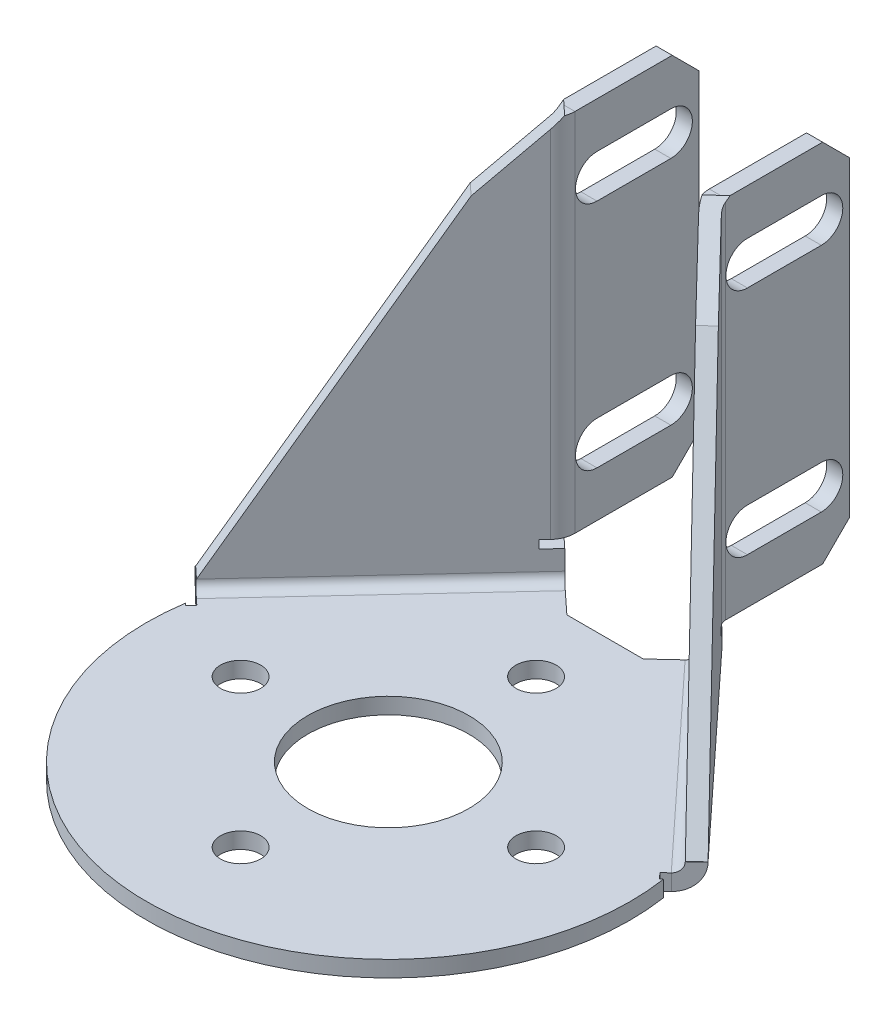
from build123d import *
from OCP.BRepFilletAPI import BRepFilletAPI_MakeChamfer

# Parameters (mm, degrees)
T_LE_DE_BASE_PLI_E1_DEPTH       = 1.2
ESQUISSE12_R                    = 1.5
ESQUISSE12_R_2                  = 6
ENL_V_MAT_EXTRU_1_DEPTH         = 26.579729358
T_LE_START                      = -10.493561241
T_LE_PLI_E_SUR_AR_TE1_OUTLINE_W = 1.3366
T_LE_PLI_E_SUR_AR_TE1_OUTLINE_H = 1.2
T_LE_PLI_E_SUR_AR_TE1_DEPTH     = 0.6
T_LE_START_2                    = 9.540892015
T_LE_PLI_E_SUR_AR_TE1_2_DEPTH   = 0.6
T_LE_START_3                    = -9.893561241
T_LE_PLI_E_SUR_AR_TE1_3_DEPTH   = 19.434453256
T_LE_PLI_E_SUR_AR_TE1_4_DEPTH   = 2
T_LE_PLI_E_SUR_AR_TE1_5_DEPTH   = 19.434453256
T_LE_START_4                    = 16
T_LE_PLI_E_SUR_AR_TE1_6_DEPTH   = 1.2
T_LE_START_5                    = 2.2
T_LE_PLI_E_SUR_AR_TE2_DEPTH     = 27.8
T_LE_PLI_E_SUR_AR_TE2_2_DEPTH   = 0.6
T_LE_START_6                    = 2.8
T_LE_PLI_E_SUR_AR_TE2_3_DEPTH   = 27.2
CHANFREIN1_SIZE                 = 2
CHANFREIN1_SIZE2                = 5.740607303
CHANFREIN1_OF_SYM_TRIE1_SIZE    = 2
CHANFREIN1_OF_SYM_TRIE1_SIZE2   = 5.740607303
ENL_V_MAT_EXTRU_2_DEPTH         = 46.34668098
ENL_V_MAT_EXTRU_2_DEPTH_BACK    = 46.34668098
ENL_V_MAT_EXTRU_7_DEPTH         = 2


with BuildPart() as part:
    # Tôle de base pliée1: sheet metal written as solids
    # Esquisse1 → Tôle de base pliée1 (new body)
    with BuildSketch(Plane(origin=(0, 0, 0), x_dir=(1, 0, 0), z_dir=(0, 1, 0))):
        with BuildLine():
            Line((-5, 18.135119355), (-17.337811592, 4.837384541))
            ThreePointArc((-17.337811592, 4.837384541), (0, -18), (17.337811592, 4.837384541))
            Line((17.337811592, 4.837384541), (5, 18.135119355))
            Line((5, 18.135119355), (-5, 18.135119355))
        make_face()
    extrude(amount=-T_LE_DE_BASE_PLI_E1_DEPTH)

    # Esquisse12 → Enlèv. mat.-Extru.1 (cut, through all)
    with BuildSketch(Plane(origin=(0, 0, 0), x_dir=(1, 0, 0), z_dir=(0, 1, 0))):
        with Locations(Location((11, 0, 0), (0, 0, 270))):
            Circle(ESQUISSE12_R)
        with Locations(Location((0, 11, 0), (0, 0, 270))):
            Circle(ESQUISSE12_R)
        with Locations(Location((-11, 0, 0), (0, 0, 270))):
            Circle(ESQUISSE12_R)
        with Locations(Location((0, -11, 0), (0, 0, 270))):
            Circle(ESQUISSE12_R)
        with Locations(Location((0, 0, 0), (0, 0, 270))):
            Circle(ESQUISSE12_R_2)
    extrude(amount=-ENL_V_MAT_EXTRU_1_DEPTH, mode=Mode.SUBTRACT)

    # Tôle pliée sur arête1: read off the stored shape, not the designer's step
    # Tôle pliée sur arête1 outline → Tôle pliée sur arête1 (cut)
    with BuildSketch(Plane(origin=(0, 0, 0), x_dir=(0.7330706501266544, 0, -0.6801524990198037), z_dir=(0.6801524990198037, 0, 0.7330706501266546)).offset(T_LE_START)):
        with Locations((15.3317, -0.6)):
            Rectangle(T_LE_PLI_E_SUR_AR_TE1_OUTLINE_W, T_LE_PLI_E_SUR_AR_TE1_OUTLINE_H)
    t_le_pli_e_sur_ar_te1 = extrude(amount=T_LE_PLI_E_SUR_AR_TE1_DEPTH, mode=Mode.SUBTRACT)

    # T_le pli_e sur ar_te1 2 outline → T_le pli_e sur ar_te1 2 (cut)
    with BuildSketch(Plane(origin=(0, 0, 0), x_dir=(0.7330706501266544, 0, -0.6801524990198037), z_dir=(0.6801524990198037, 0, 0.7330706501266546)).offset(T_LE_START_2)):
        with BuildLine():
            Line((14.6634, 0), (14.6634, -1.2))
            Line((14.6634, -1.2), (15.2634, -1.2))
            ThreePointArc((15.2634, -1.2), (15.638821762, -1.163262642), (16, -1.054444388))
            Line((16, -1.054444388), (16, 0))
            Line((16, 0), (14.6634, 0))
        make_face()
    t_le_pli_e_sur_ar_te1_2 = extrude(amount=T_LE_PLI_E_SUR_AR_TE1_2_DEPTH, mode=Mode.SUBTRACT)

    # T_le pli_e sur ar_te1 3 outline → T_le pli_e sur ar_te1 3 (cut)
    with BuildSketch(Plane(origin=(0, 0, 0), x_dir=(0.7330706501266544, 0, -0.6801524990198037), z_dir=(0.6801524990198037, 0, 0.7330706501266546)).offset(T_LE_START_3)):
        with BuildLine():
            ThreePointArc((16, -1.054444388), (15.638821762, -1.163262642), (15.2634, -1.2))
            Line((15.2634, -1.2), (16, -1.2))
            Line((16, -1.2), (16, -1.054444388))
        make_face()
    t_le_pli_e_sur_ar_te1_3 = extrude(amount=T_LE_PLI_E_SUR_AR_TE1_3_DEPTH, mode=Mode.SUBTRACT)

    # T_le pli_e sur ar_te1 4 outline → T_le pli_e sur ar_te1 4 (add)
    with BuildSketch(Plane(origin=(0, 0, 0), x_dir=(0.7330706501266544, 0, -0.6801524990198037), z_dir=(0.6801524990198037, 0, 0.7330706501266546)).offset(T_LE_START_3)):
        with BuildLine():
            ThreePointArc((16, 0.7366), (15.784254855, 0.215745145), (15.2634, 0))
            Line((15.2634, 0), (16, 0))
            Line((16, 0), (16, -1.054444388))
            ThreePointArc((16, -1.054444388), (16.872269031, -0.341342484), (17.2, 0.7366))
            Line((17.2, 0.7366), (17.2, 30))
            Line((17.2, 30), (16, 30))
            Line((16, 30), (16, 0.7366))
        make_face()
    t_le_pli_e_sur_ar_te1_4 = extrude(amount=T_LE_PLI_E_SUR_AR_TE1_4_DEPTH)

    # T_le pli_e sur ar_te1 5 outline → T_le pli_e sur ar_te1 5 (add)
    with BuildSketch(Plane(origin=(0, 0, 0), x_dir=(0.7330706501266544, 0, -0.6801524990198037), z_dir=(0.6801524990198037, 0, 0.7330706501266546)).offset(T_LE_START_3)):
        with BuildLine():
            Line((14.6634, 0), (14.6634, -1.2))
            Line((14.6634, -1.2), (15.2634, -1.2))
            ThreePointArc((15.2634, -1.2), (16.632782992, -0.632782992), (17.2, 0.7366))
            Line((17.2, 0.7366), (16, 0.7366))
            ThreePointArc((16, 0.7366), (15.784254855, 0.215745145), (15.2634, 0))
            Line((15.2634, 0), (14.6634, 0))
        make_face()
    t_le_pli_e_sur_ar_te1_5 = extrude(amount=T_LE_PLI_E_SUR_AR_TE1_5_DEPTH)

    # T_le pli_e sur ar_te1 6 outline → T_le pli_e sur ar_te1 6 (add)
    with BuildSketch(Plane(origin=(0, 0, 0), x_dir=(0.6801524990198036, 0, 0.7330706501266546), z_dir=(0.7330706501266546, 0, -0.6801524990198037)).offset(T_LE_START_4)):
        Polygon((-7.893561241, -30), (9.508185371, -0.7366), (-7.893561241, -0.7366), align=None)
    t_le_pli_e_sur_ar_te1_6 = extrude(amount=T_LE_PLI_E_SUR_AR_TE1_6_DEPTH)

    # Tôle pliée sur arête2: read off the stored shape, not the designer's step
    # Tôle pliée sur arête2 outline → Tôle pliée sur arête2 (cut)
    with BuildSketch(Plane(origin=(0, 0, 0), x_dir=(1, 0, 0), z_dir=(0, 1, 0)).offset(T_LE_START_5)):
        with BuildLine():
            Line((5, 18.135119355), (5.516935379, 17.577964666))
            ThreePointArc((5.516935379, 17.577964666), (5.281888127, 17.88899285), (5.113898069, 18.240795467))
            Line((5.113898069, 18.240795467), (5, 18.135119355))
        make_face()
    t_le_pli_e_sur_ar_te2 = extrude(amount=T_LE_PLI_E_SUR_AR_TE2_DEPTH, mode=Mode.SUBTRACT)

    # T_le pli_e sur ar_te2 2 outline → T_le pli_e sur ar_te2 2 (cut)
    with BuildSketch(Plane(origin=(0, 0, 0), x_dir=(1, 0, 0), z_dir=(0, 1, 0)).offset(T_LE_START_5)):
        with BuildLine():
            Line((5.925026878, 17.138122276), (6.804711659, 17.954305274))
            Line((6.804711659, 17.954305274), (5.87968478, 18.951302354))
            Line((5.87968478, 18.951302354), (5.113898069, 18.240795467))
            ThreePointArc((5.113898069, 18.240795467), (5.281888127, 17.88899285), (5.516935379, 17.577964666))
            Line((5.516935379, 17.577964666), (5.925026878, 17.138122276))
        make_face()
    t_le_pli_e_sur_ar_te2_2 = extrude(amount=T_LE_PLI_E_SUR_AR_TE2_2_DEPTH, mode=Mode.SUBTRACT)

    # T_le pli_e sur ar_te2 3 outline → T_le pli_e sur ar_te2 3 (add)
    with BuildSketch(Plane(origin=(0, 0, 0), x_dir=(1, 0, 0), z_dir=(0, 1, 0)).offset(T_LE_START_6)):
        with BuildLine():
            Line((5.87968478, 18.951302354), (6.396620159, 18.394147664))
            ThreePointArc((6.396620159, 18.394147664), (6.250914682, 18.626047262), (6.2, 18.895147995))
            Line((6.2, 18.895147995), (6.2, 28.135119355))
            Line((6.2, 28.135119355), (5, 28.135119355))
            Line((5, 28.135119355), (5, 18.895147995))
            ThreePointArc((5, 18.895147995), (5.028686989, 18.563052376), (5.113898069, 18.240795467))
            Line((5.113898069, 18.240795467), (5.87968478, 18.951302354))
        make_face()
    t_le_pli_e_sur_ar_te2_3 = extrude(amount=T_LE_PLI_E_SUR_AR_TE2_3_DEPTH)

    # Chanfrein1: one chamfer whose edges measure the first distance from different faces: ONE call of the kernel's chamfer builder (chamfer() names one face for all edges)
    chanfrein1_edges_1 = [part.edges().sort_by_distance(p)[0] for p in [
        (5.6, 2.8, -28.135119355),
        (5.6, 30, -28.135119355),
    ]]
    chanfrein1_edges_2 = [part.edges().sort_by_distance(p)[0] for p in [
        (6.800147388, 30, -17.077069554),
    ]]
    chanfrein1_side_2 = [part.faces().sort_by_distance(p)[0] for p in [
        (5.687529449, 30, -22.422147631),
    ]]
    chanfrein1 = BRepFilletAPI_MakeChamfer(part.part.solid().wrapped)
    for e in chanfrein1_edges_1:
        chanfrein1.Add(CHANFREIN1_SIZE, e.wrapped)
    for e in chanfrein1_edges_2:
        chanfrein1.Add(CHANFREIN1_SIZE, CHANFREIN1_SIZE2, e.wrapped, chanfrein1_side_2[0].wrapped)  # the first distance lies on this face
    add(Compound.cast(chanfrein1.Shape()), mode=Mode.REPLACE)

    # Symétrie1: Tôle pliée sur arête1, T_le pli_e sur ar_te1 2, T_le pli_e sur ar_te1 3, T_le pli_e sur ar_te1 4, T_le pli_e sur ar_te1 5, T_le pli_e sur ar_te1 6, Tôle pliée sur arête2, T_le pli_e sur ar_te2 2, T_le pli_e sur ar_te2 3 across plane
    add(t_le_pli_e_sur_ar_te1.mirror(Plane(origin=(0, 0, 0), x_dir=(0, 0, 1), z_dir=(1, 0, 0))), mode=Mode.SUBTRACT)
    add(t_le_pli_e_sur_ar_te1_2.mirror(Plane(origin=(0, 0, 0), x_dir=(0, 0, 1), z_dir=(1, 0, 0))), mode=Mode.SUBTRACT)
    add(t_le_pli_e_sur_ar_te1_3.mirror(Plane(origin=(0, 0, 0), x_dir=(0, 0, 1), z_dir=(1, 0, 0))), mode=Mode.SUBTRACT)
    add(t_le_pli_e_sur_ar_te1_4.mirror(Plane(origin=(0, 0, 0), x_dir=(0, 0, 1), z_dir=(1, 0, 0))))
    add(t_le_pli_e_sur_ar_te1_5.mirror(Plane(origin=(0, 0, 0), x_dir=(0, 0, 1), z_dir=(1, 0, 0))))
    add(t_le_pli_e_sur_ar_te1_6.mirror(Plane(origin=(0, 0, 0), x_dir=(0, 0, 1), z_dir=(1, 0, 0))))
    add(t_le_pli_e_sur_ar_te2.mirror(Plane(origin=(0, 0, 0), x_dir=(0, 0, 1), z_dir=(1, 0, 0))), mode=Mode.SUBTRACT)
    add(t_le_pli_e_sur_ar_te2_2.mirror(Plane(origin=(0, 0, 0), x_dir=(0, 0, 1), z_dir=(1, 0, 0))), mode=Mode.SUBTRACT)
    add(t_le_pli_e_sur_ar_te2_3.mirror(Plane(origin=(0, 0, 0), x_dir=(0, 0, 1), z_dir=(1, 0, 0))))

    # Chanfrein1 of Symétrie1: one chamfer whose edges measure the first distance from different faces: ONE call of the kernel's chamfer builder (chamfer() names one face for all edges)
    chanfrein1_of_sym_trie1_edges_1 = [part.edges().sort_by_distance(p)[0] for p in [
        (-5.6, 2.8, -28.135119355),
        (-5.6, 30, -28.135119355),
    ]]
    chanfrein1_of_sym_trie1_edges_2 = [part.edges().sort_by_distance(p)[0] for p in [
        (-6.800147388, 30, -17.077069554),
    ]]
    chanfrein1_of_sym_trie1_side_2 = [part.faces().sort_by_distance(p)[0] for p in [
        (-5.687529449, 30, -22.422147631),
    ]]
    chanfrein1_of_sym_trie1 = BRepFilletAPI_MakeChamfer(part.part.solid().wrapped)
    for e in chanfrein1_of_sym_trie1_edges_1:
        chanfrein1_of_sym_trie1.Add(CHANFREIN1_OF_SYM_TRIE1_SIZE, e.wrapped)
    for e in chanfrein1_of_sym_trie1_edges_2:
        chanfrein1_of_sym_trie1.Add(CHANFREIN1_OF_SYM_TRIE1_SIZE, CHANFREIN1_OF_SYM_TRIE1_SIZE2, e.wrapped, chanfrein1_of_sym_trie1_side_2[0].wrapped)  # the first distance lies on this face
    add(Compound.cast(chanfrein1_of_sym_trie1.Shape()), mode=Mode.REPLACE)

    # Esquisse13 → Enlèv. mat.-Extru.2 (cut, two sides: drawn at the far end of the back side and taken through both)
    with BuildSketch(Plane(origin=(0, 0, 0), x_dir=(0, 0, -1), z_dir=(1, 0, 0)).offset(-ENL_V_MAT_EXTRU_2_DEPTH_BACK)):
        with BuildLine():
            Line((26.035119355, 23.4), (20.535119355, 23.4))
            ThreePointArc((20.535119355, 23.4), (18.935119355, 25), (20.535119355, 26.6))
            Line((20.535119355, 26.6), (26.035119355, 26.6))
            ThreePointArc((26.035119355, 26.6), (27.635119355, 25), (26.035119355, 23.4))
        make_face()
        with BuildLine():
            Line((26.035119355, 6.2), (20.535119355, 6.2))
            ThreePointArc((20.535119355, 6.2), (18.935119355, 7.8), (20.535119355, 9.4))
            Line((20.535119355, 9.4), (26.035119355, 9.4))
            ThreePointArc((26.035119355, 9.4), (27.635119355, 7.8), (26.035119355, 6.2))
        make_face()
    extrude(amount=ENL_V_MAT_EXTRU_2_DEPTH + ENL_V_MAT_EXTRU_2_DEPTH_BACK, mode=Mode.SUBTRACT)

    # Esquisse15 → Enlèv. mat.-Extru.7 (cut)
    with BuildSketch(Plane.XZ.offset(1.2)):
        Polygon((4.117844894, -17.316780768), (2.84424625, -16.135119355), (-2.84424625, -16.135119355), (-4.117844894, -17.316780768), (-4.117844894, -18.135119355), (4.117844894, -18.135119355), align=None)
    extrude(amount=-ENL_V_MAT_EXTRU_7_DEPTH, mode=Mode.SUBTRACT)


solid = part.part
